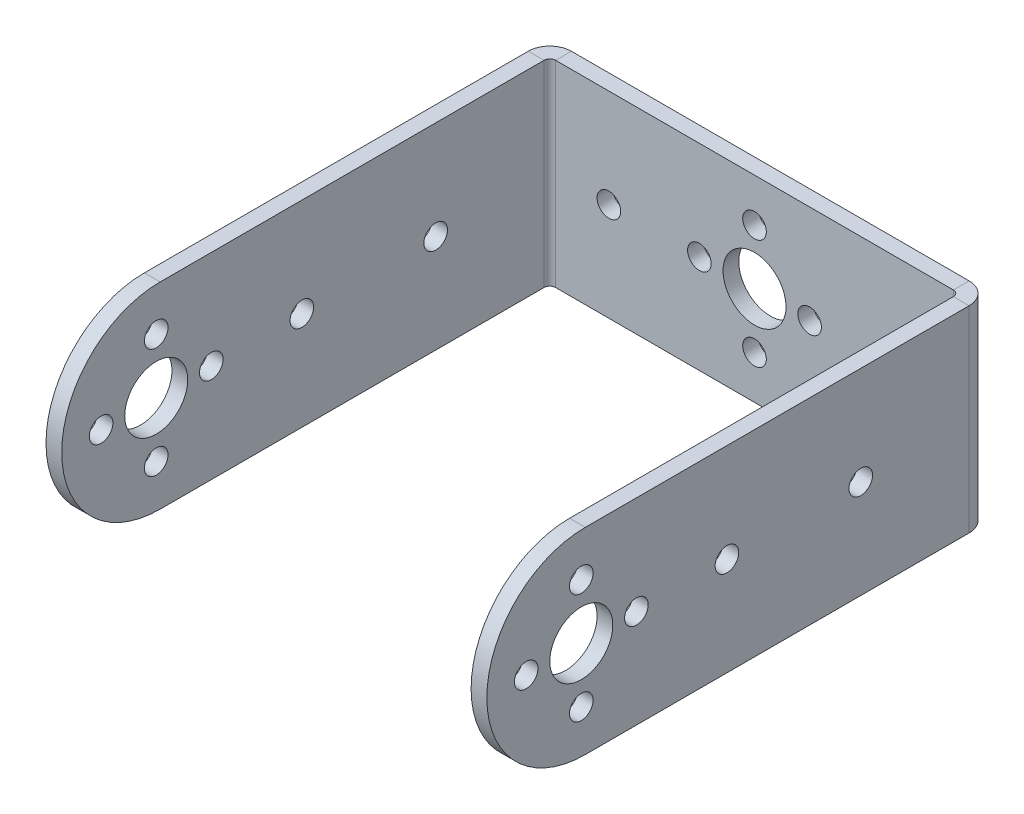
from build123d import *

# Parameters (mm, degrees)
SKETCH_1_W                         = 54
SKETCH_1_H                         = 25
SKETCH_1_R                         = 4
SKETCH_1_R_2                       = 1.5
SM_BASE_FLANGE_1_DEPTH             = 2
SM_EDGE_FLANGE_1_STRIP_W           = 10.4732
SM_EDGE_FLANGE_1_STRIP_H           = 2
SM_EDGE_FLANGE_1_STRIP_CUT_DEPTH   = 25
SM_EDGE_FLANGE_1_STRIP_2_W         = 10.4732
SM_EDGE_FLANGE_1_STRIP_2_H         = 2
SM_EDGE_FLANGE_1_STRIP_CUT_2_DEPTH = 25
SM_EDGE_FLANGE_1_DEPTH             = 25
SM_EDGE_FLANGE_1_BEND_DEPTH        = 25
SKETCH_12_R                        = 4
SKETCH_12_R_2                      = 1.5
CUT_EXTRUDE_1_DEPTH                = 72


# Sheet-metal steps are written as plain solids
with BuildPart() as part:
    # Sketch 1 → 基体-法兰1 (new body)
    with BuildSketch(Plane.XY):
        with Locations((27, -12.5)):
            Rectangle(SKETCH_1_W, SKETCH_1_H)
        with Locations((27, -12.5)):
            Circle(SKETCH_1_R, mode=Mode.SUBTRACT)
        with Locations((27, -5.5)):
            Circle(SKETCH_1_R_2, mode=Mode.SUBTRACT)
        with Locations((27, -19.5)):
            Circle(SKETCH_1_R_2, mode=Mode.SUBTRACT)
        with Locations((34, -12.5)):
            Circle(SKETCH_1_R_2, mode=Mode.SUBTRACT)
        with Locations((20, -12.5)):
            Circle(SKETCH_1_R_2, mode=Mode.SUBTRACT)
        with Locations((45.5, -12.5)):
            Circle(SKETCH_1_R_2, mode=Mode.SUBTRACT)
        with Locations((8.5, -12.5)):
            Circle(SKETCH_1_R_2, mode=Mode.SUBTRACT)
    extrude(amount=-SM_BASE_FLANGE_1_DEPTH)

    # 边线-法兰1 strip (across the edge) → 边线-法兰1 strip cut (cut)
    with BuildSketch(Plane(origin=(-1, 0, 0), x_dir=(1, 0, 0), z_dir=(0, -1, 0))):
        with Locations((-2.5, -1)):
            Rectangle(SM_EDGE_FLANGE_1_STRIP_W, SM_EDGE_FLANGE_1_STRIP_H)
    extrude(amount=SM_EDGE_FLANGE_1_STRIP_CUT_DEPTH, mode=Mode.SUBTRACT)

    # 边线-法兰1 strip 2 (across the edge) → 边线-法兰1 strip cut 2 (cut)
    with BuildSketch(Plane(origin=(55, -25, 0), x_dir=(-1, 0, 0), z_dir=(0, 1, 0))):
        with Locations((-2.5, -1)):
            Rectangle(SM_EDGE_FLANGE_1_STRIP_2_W, SM_EDGE_FLANGE_1_STRIP_2_H)
    extrude(amount=SM_EDGE_FLANGE_1_STRIP_CUT_2_DEPTH, mode=Mode.SUBTRACT)

    # 边线-法兰1 section (across the edge) → 边线-法兰1 (add)
    with BuildSketch(Plane(origin=(-1, 0, 0), x_dir=(1, 0, 0), z_dir=(0, -1, 0))):
        with BuildLine():
            Line((0, 0.7366), (0, 68))
            Line((0, 68), (2, 68))
            Line((2, 68), (2, 0.7366))
            ThreePointArc((2, 0.7366), (2.215745145, 0.215745145), (2.7366, 0))
            Line((2.7366, 0), (2.7366, -2))
            ThreePointArc((2.7366, -2), (0.801531583, -1.198468417), (0, 0.7366))
        make_face()
    extrude(amount=SM_EDGE_FLANGE_1_DEPTH)

    # 边线-法兰1 section 2 (across the edge) → 边线-法兰1 bend (add)
    with BuildSketch(Plane(origin=(55, -25, 0), x_dir=(-1, 0, 0), z_dir=(0, 1, 0))):
        with BuildLine():
            Line((0, 0.7366), (0, 68))
            Line((0, 68), (2, 68))
            Line((2, 68), (2, 0.7366))
            ThreePointArc((2, 0.7366), (2.215745145, 0.215745145), (2.7366, 0))
            Line((2.7366, 0), (2.7366, -2))
            ThreePointArc((2.7366, -2), (0.801531583, -1.198468417), (0, 0.7366))
        make_face()
    extrude(amount=SM_EDGE_FLANGE_1_BEND_DEPTH)

    # 草图12 → 切除-拉伸1 (cut)
    with BuildSketch(Plane(origin=(55, 0, 0), x_dir=(0, 0, -1), z_dir=(1, 0, 0))):
        with Locations(Location((-50, -12.5, 0), (0, 0, 180))):
            Circle(SKETCH_12_R)
        with Locations(Location((-57, -12.5, 0), (0, 0, 180))):
            Circle(SKETCH_12_R_2)
        with Locations(Location((-50, -5.5, 0), (0, 0, 180))):
            Circle(SKETCH_12_R_2)
        with Locations(Location((-43, -12.5, 0), (0, 0, 180))):
            Circle(SKETCH_12_R_2)
        with Locations(Location((-50, -19.5, 0), (0, 0, 180))):
            Circle(SKETCH_12_R_2)
        with Locations(Location((-31.5, -12.5, 0), (0, 0, 180))):
            Circle(SKETCH_12_R_2)
        with Locations(Location((-14.5, -12.5, 0), (0, 0, 180))):
            Circle(SKETCH_12_R_2)
        with BuildLine():
            Line((-49.5, -25), (-68, -25))
            Line((-68, -25), (-68, 0))
            Line((-68, 0), (-49.5, 0))
            ThreePointArc((-49.5, 0), (-62, -12.5), (-49.5, -25))
        make_face()
    extrude(amount=-CUT_EXTRUDE_1_DEPTH, mode=Mode.SUBTRACT)


solid = part.part
